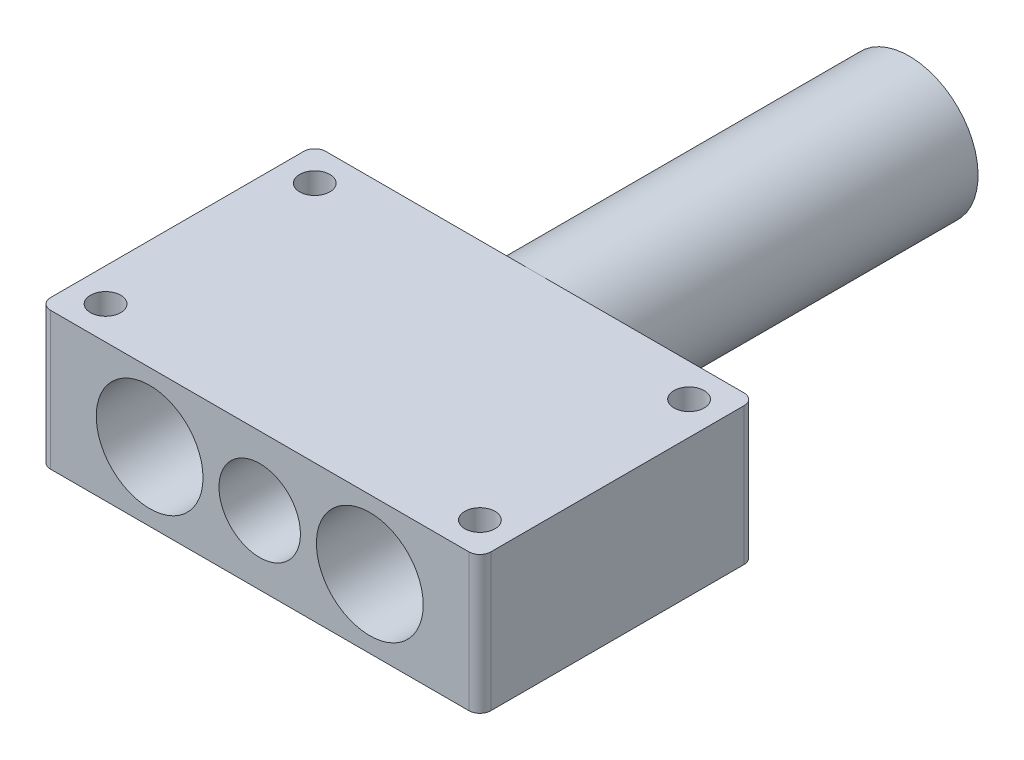
from build123d import *
from OCP.BRepFilletAPI import BRepFilletAPI_MakeChamfer

# Parameters (mm, degrees)
SKETCH1_W            = 80
SKETCH1_H            = 50
BOSS_EXTRUDE1_DEPTH  = 25
M5_CLEARANCE_HOLE1_D = 5.5
SKETCH5_R            = 12.5
SKETCH5_R_2          = 6.985
BOSS_EXTRUDE2_DEPTH  = 68
SKETCH4_R            = 9.7
CUT_EXTRUDE2_DEPTH   = 29
SKETCH4_4_R          = 7.4
CUT_EXTRUDE3_DEPTH   = 128.078715763
SKETCH6_R            = 6.5
CUT_EXTRUDE4_DEPTH   = 101.727354775
BOSS_EXTRUDE3_START  = 1.3
SKETCH7_R            = 9.7
SKETCH7_R_2          = 9.5
BOSS_EXTRUDE3_DEPTH  = 1.3
CHAMFER2_SIZE        = 0.2
HOLE2_D              = 4.8
HOLE2_DEPTH          = 6
HOLE2_CBORE_D        = 5.4
HOLE2_CBORE_DEPTH    = 4
CHAMFER3_SIZE        = 4
CHAMFER3_SIZE_2      = 0.3
FILLET1_R            = 2


with BuildPart() as part:
    # Sketch1 → Boss-Extrude1 (new body)
    with BuildSketch(Plane(origin=(0, 0, 0), x_dir=(1, 0, 0), z_dir=(0, 1, 0))):
        Rectangle(SKETCH1_W, SKETCH1_H)
    extrude(amount=BOSS_EXTRUDE1_DEPTH)

    # M5 Clearance Hole1 (through all)
    with Locations(Plane(origin=(0, 25, 0), x_dir=(1, 0, 0), z_dir=(0, 1, 0))):
        with Locations((-34, 19), (34, 19), (34, -19), (-34, -19)):
            Hole(M5_CLEARANCE_HOLE1_D / 2)

    # Sketch5 → Boss-Extrude2 (add)
    with BuildSketch(Plane(origin=(0, 0, -25), x_dir=(-1, 0, 0), z_dir=(0, 0, -1))):
        with Locations(Location((0, 12.5, 0), (0, 0, 270))):
            Circle(SKETCH5_R)
        with Locations((0, 12.5)):
            Circle(SKETCH5_R_2, mode=Mode.SUBTRACT)
    extrude(amount=BOSS_EXTRUDE2_DEPTH)

    # Sketch4 → Cut-Extrude2 (cut)
    with BuildSketch(Plane.XY.offset(25)):
        with Locations((-20, 12.5)):
            Circle(SKETCH4_R)
        with Locations((20, 12.5)):
            Circle(SKETCH4_R)
    extrude(amount=-CUT_EXTRUDE2_DEPTH, mode=Mode.SUBTRACT)

    # Sketch4<4> → Cut-Extrude3 (cut, through all)
    with BuildSketch(Plane.XY.offset(25)):
        with Locations((0, 12.5)):
            Circle(SKETCH4_4_R)
    extrude(amount=-CUT_EXTRUDE3_DEPTH, mode=Mode.SUBTRACT)

    # Sketch6 → Cut-Extrude4 (cut, through all)
    with BuildSketch(Plane.XY.offset(-4)):
        with Locations((-20, 12.5)):
            Circle(SKETCH6_R)
        with Locations((20, 12.5)):
            Circle(SKETCH6_R)
    extrude(amount=-CUT_EXTRUDE4_DEPTH, mode=Mode.SUBTRACT)

    # Sketch7 → Boss-Extrude3 (add)
    # profile 1 of 2: a face of its own
    with BuildSketch(Plane.XY.offset(-0.5).offset(BOSS_EXTRUDE3_START)):
        with Locations((-20, 12.5)):
            Circle(SKETCH7_R)
        with Locations((-20, 12.5)):
            Circle(SKETCH7_R_2, mode=Mode.SUBTRACT)
    # profile 2 of 2: a face of its own
    with BuildSketch(Plane.XY.offset(-0.5).offset(BOSS_EXTRUDE3_START)):
        with Locations((20, 12.5)):
            Circle(SKETCH7_R)
        with Locations((20, 12.5)):
            Circle(SKETCH7_R_2, mode=Mode.SUBTRACT)
    extrude(amount=-BOSS_EXTRUDE3_DEPTH)

    # Chamfer2
    chamfer2_edges = [part.edges().sort_by_distance(p)[0] for p in [
        (-29.5, 12.5, -0.5),
        (-29.5, 12.5, 0.8),
        (10.5, 12.5, -0.5),
        (10.5, 12.5, 0.8),
    ]]
    chamfer(chamfer2_edges, length=CHAMFER2_SIZE - 0.0001)  # a hair under: the kernel refuses the full size

    # Hole2
    with Locations(Plane(origin=(0, 0, 0), x_dir=(-1, 0, 0), z_dir=(0, -1, 0))):
        with Locations((-9, 0), (9, 0)):
            CounterBoreHole(HOLE2_D / 2, HOLE2_CBORE_D / 2, HOLE2_CBORE_DEPTH, depth=HOLE2_DEPTH)

    # Chamfer3
    chamfer3_edges_1 = [part.edges().sort_by_distance(p)[0] for p in [
        (-6.3, 4, 0),
    ]]
    chamfer3_side_1 = [part.faces().sort_by_distance(p)[0] for p in [
        (-6.3, 3.994, 0),
    ]]
    chamfer3_edges_2 = [part.edges().sort_by_distance(p)[0] for p in [
        (11.7, 4, 0),
    ]]
    chamfer3_side_2 = [part.faces().sort_by_distance(p)[0] for p in [
        (11.7, 3.994, 0),
    ]]
    chamfer3 = BRepFilletAPI_MakeChamfer(part.part.solid().wrapped)
    for e in chamfer3_edges_1:
        chamfer3.Add(CHAMFER3_SIZE - 0.0001, CHAMFER3_SIZE_2 - 0.0001, e.wrapped, chamfer3_side_1[0].wrapped)
    for e in chamfer3_edges_2:
        chamfer3.Add(CHAMFER3_SIZE - 0.0001, CHAMFER3_SIZE_2 - 0.0001, e.wrapped, chamfer3_side_2[0].wrapped)
    add(Compound.cast(chamfer3.Shape()), mode=Mode.REPLACE)  # a hair under: the kernel refuses the full size

    # Fillet1
    fillet1_edges = [part.edges().sort_by_distance(p)[0] for p in [
        (40, 12.5, 25),
        (-40, 12.5, 25),
        (-40, 12.5, -25),
        (40, 12.5, -25),
    ]]
    fillet(fillet1_edges, radius=FILLET1_R)


solid = part.part
